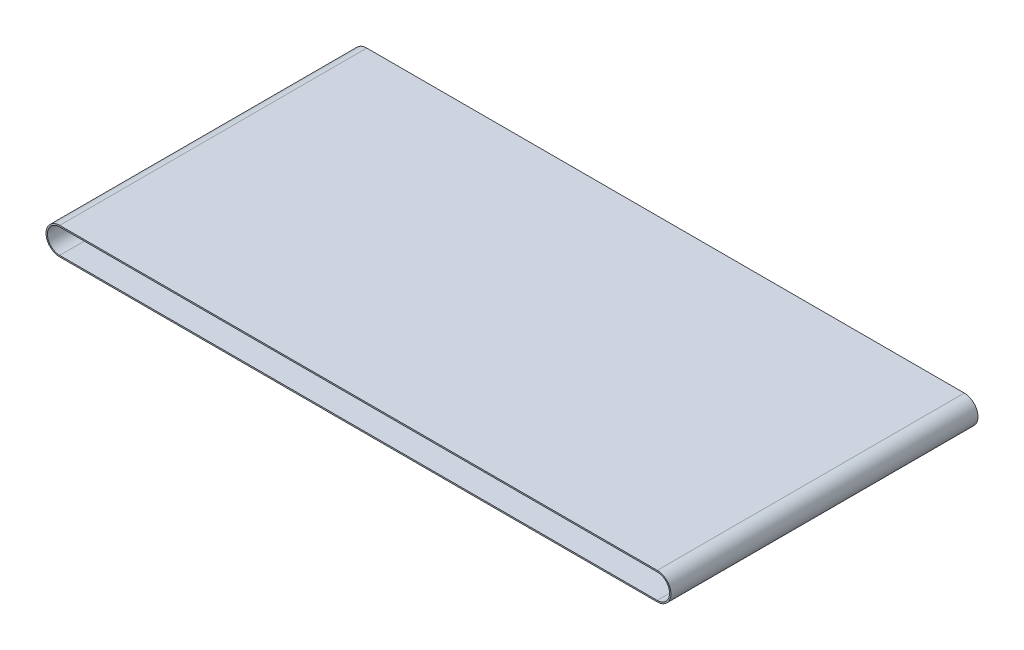
from build123d import *

# Parameters (mm, degrees)
BOSS_EXTRU_1_DEPTH      = 285
ENL_V_MAT_EXTRU_1_REACH = 815.6


with BuildPart() as part:
    # Esquisse1 → Boss.-Extru.1 (new, symmetric)
    with BuildSketch(Plane.XY):
        with BuildLine():
            Line((-554.6, 25.4), (554.6, 25.4))
            ThreePointArc((554.6, 25.4), (580, 0), (554.6, -25.4))
            Line((554.6, -25.4), (-554.6, -25.4))
            ThreePointArc((-554.6, -25.4), (-580, 0), (-554.6, 25.4))
        make_face()
    extrude(amount=BOSS_EXTRU_1_DEPTH, both=True)

    # Esquisse2 → Enlèv. mat.-Extru.1 (cut, up to next)
    with BuildSketch(Plane.XY.offset(285), mode=Mode.PRIVATE) as enl_v_mat_extru_1_sk1:
        with BuildLine():
            Line((-554.6, 22.86), (554.6, 22.86))
            ThreePointArc((554.6, 22.86), (577.46, 0), (554.6, -22.86))
            Line((554.6, -22.86), (-554.6, -22.86))
            ThreePointArc((-554.6, -22.86), (-577.46, 0), (-554.6, 22.86))
        make_face()
    enl_v_mat_extru_1_tool1 = extrude(enl_v_mat_extru_1_sk1.sketch, amount=-ENL_V_MAT_EXTRU_1_REACH, mode=Mode.PRIVATE) & part.part
    add(enl_v_mat_extru_1_tool1.solids().sort_by_distance((0, 0, 285))[0], mode=Mode.SUBTRACT)


solid = part.part
